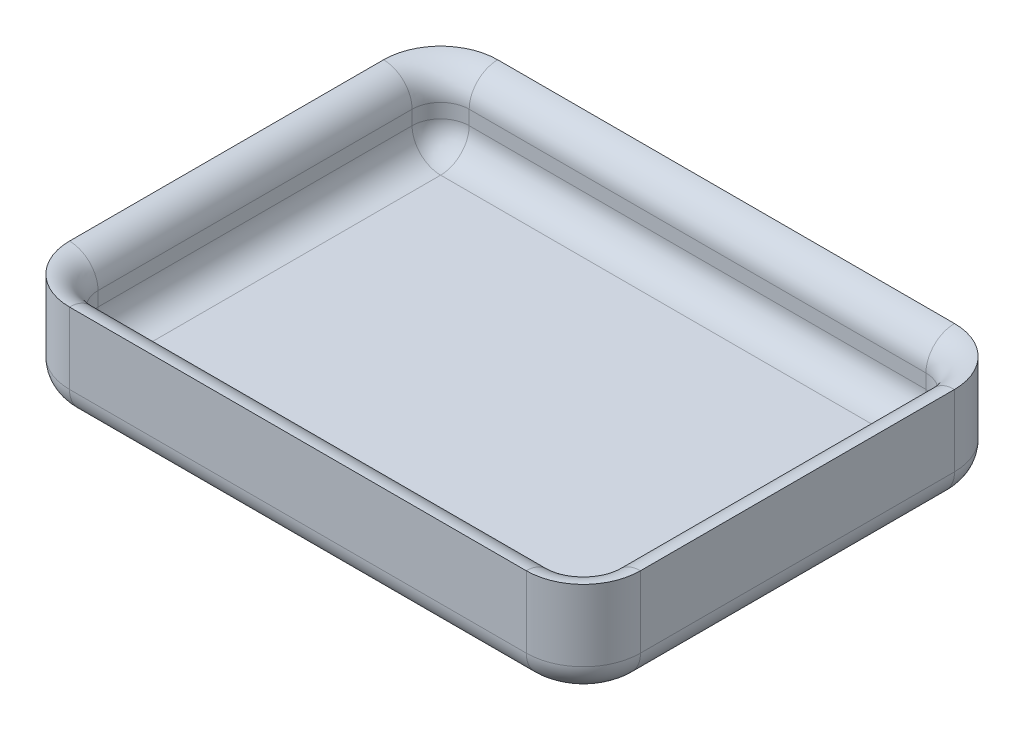
from build123d import *

# Parameters (mm, degrees)
BOSS_EXTRU_1_DEPTH      = 7
ENL_V_MAT_EXTRU_1_DEPTH = 5
CONG_1_R                = 2
CONG_2_R                = 2
CONG_3_R                = 2


with BuildPart() as part:
    # Esquisse1 → Boss.-Extru.1 (new body)
    with BuildSketch(Plane(origin=(0, 0, 0), x_dir=(1, 0, 0), z_dir=(0, 1, 0))):
        with BuildLine():
            Line((-16, -15), (16, -15))
            ThreePointArc((16, -15), (18.828427125, -13.828427125), (20, -11))
            Line((20, -11), (20, 11))
            ThreePointArc((20, 11), (18.828427125, 13.828427125), (16, 15))
            Line((16, 15), (-16, 15))
            ThreePointArc((-16, 15), (-18.828427125, 13.828427125), (-20, 11))
            Line((-20, 11), (-20, -11))
            ThreePointArc((-20, -11), (-18.828427125, -13.828427125), (-16, -15))
        make_face()
    extrude(amount=BOSS_EXTRU_1_DEPTH)

    # Esquisse2 → Enlèv. mat.-Extru.1 (cut)
    with BuildSketch(Plane(origin=(0, 7, 0), x_dir=(1, 0, 0), z_dir=(0, 1, 0))):
        with BuildLine():
            Line((18, -11), (18, 11))
            ThreePointArc((18, 11), (17.414213562, 12.414213562), (16, 13))
            Line((16, 13), (-16, 13))
            ThreePointArc((-16, 13), (-17.414213562, 12.414213562), (-18, 11))
            Line((-18, 11), (-18, -11))
            ThreePointArc((-18, -11), (-17.414213562, -12.414213562), (-16, -13))
            Line((-16, -13), (16, -13))
            ThreePointArc((16, -13), (17.414213562, -12.414213562), (18, -11))
        make_face()
    extrude(amount=-ENL_V_MAT_EXTRU_1_DEPTH, mode=Mode.SUBTRACT)

    # Congé1
    cong_1_edges = [part.edges().sort_by_distance(p)[0] for p in [
        (17.414213562, 2, -12.414213562),
        (18, 2, 0),
        (17.414213562, 2, 12.414213562),
        (0, 2, 13),
        (-17.414213562, 2, 12.414213562),
        (-18, 2, 0),
        (-17.414213562, 2, -12.414213562),
        (0, 2, -13),
    ]]
    fillet(cong_1_edges, radius=CONG_1_R)

    # Congé2
    cong_2_edges = [part.edges().sort_by_distance(p)[0] for p in [
        (0, 0, 15),
        (-18.828427125, 0, 13.828427125),
        (-20, 0, 0),
        (-18.828427125, 0, -13.828427125),
        (0, 0, -15),
        (18.828427125, 0, -13.828427125),
        (20, 0, 0),
        (18.828427125, 0, 13.828427125),
    ]]
    fillet(cong_2_edges, radius=CONG_2_R)

    # Congé3
    cong_3_edges = [part.edges().sort_by_distance(p)[0] for p in [
        (17.414213562, 7, -12.414213562),
        (0, 7, -13),
        (-17.414213562, 7, -12.414213562),
        (-18, 7, 0),
        (-17.414213562, 7, 12.414213562),
        (0, 7, 13),
        (17.414213562, 7, 12.414213562),
        (18, 7, 0),
    ]]
    fillet(cong_3_edges, radius=CONG_3_R - 0.0001)  # a hair under: the kernel refuses the full size


solid = part.part
